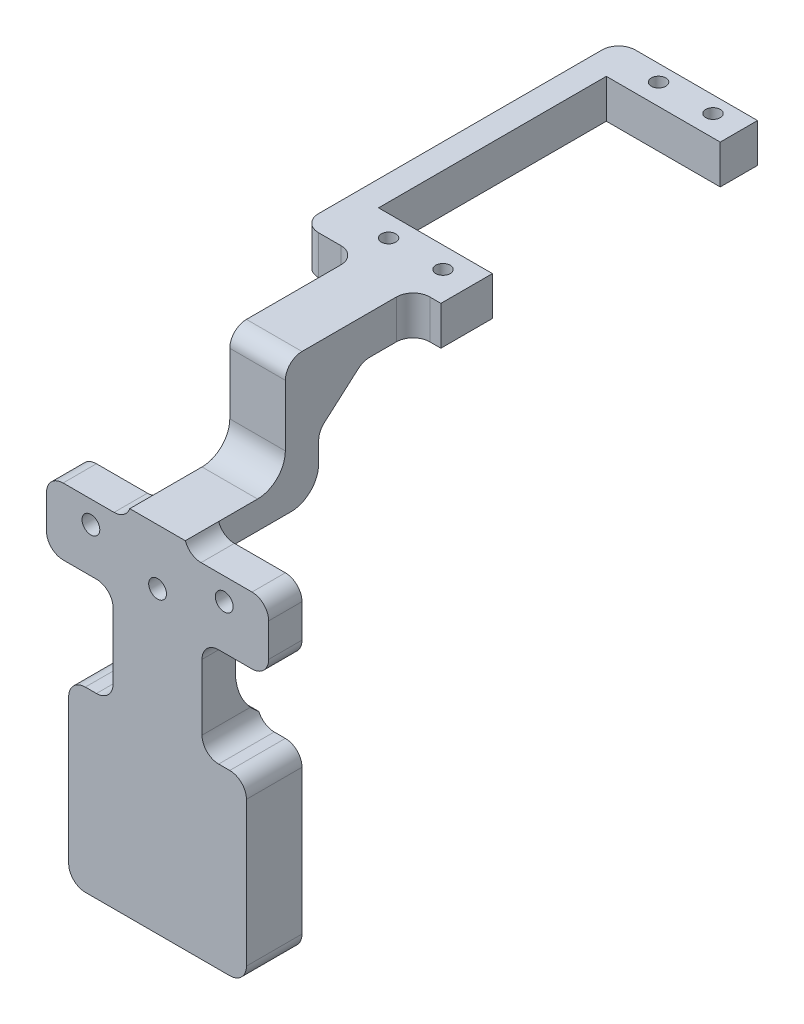
from build123d import *

# Parameters (mm, degrees)
BOSS_EXTRUDE1_DEPTH = 10
CUT_EXTRUDE1_REACH  = 126.909
FILLET1_R           = 3
SKETCH3_R           = 1.6
CUT_EXTRUDE2_DEPTH  = 6
SKETCH4_R           = 1.6
CUT_EXTRUDE3_DEPTH  = 7
BOSS_EXTRUDE2_DEPTH = 5
FILLET2_R           = 3
FILLET3_R           = 2
FILLET4_R           = 5
FILLET5_R           = 3
SKETCH7_W           = 25
SKETCH7_H           = 57
BOSS_EXTRUDE3_DEPTH = 7
SKETCH8_R           = 1.304654563
SKETCH8_W           = 21.294220064
SKETCH8_H           = 41
CUT_EXTRUDE4_DEPTH  = 7
FILLET6_R           = 3


with BuildPart() as part:
    # Sketch1 → Boss-Extrude1 (new body)
    with BuildSketch(Plane.XY):
        with BuildLine():
            Line((-13, -85.907758216), (-8, -85.907758216))
            Line((-8, -85.907758216), (-8, -68.093529717))
            Line((-8, -68.093529717), (-20, -68.093529717))
            Line((-20, -68.093529717), (-20, -56.093529717))
            Line((-20, -56.093529717), (20, -56.093529717))
            Line((20, -56.093529717), (20, -68.093529717))
            Line((20, -68.093529717), (8, -68.093529717))
            Line((8, -68.093529717), (8, -85.907758216))
            Line((8, -85.907758216), (13, -85.907758216))
            ThreePointArc((13, -85.907758216), (15.121320344, -86.786437873), (16, -88.907758216))
            Line((16, -88.907758216), (16, -114.907758216))
            ThreePointArc((16, -114.907758216), (15.121320344, -117.02907856), (13, -117.907758216))
            Line((13, -117.907758216), (-13, -117.907758216))
            ThreePointArc((-13, -117.907758216), (-15.121320344, -117.02907856), (-16, -114.907758216))
            Line((-16, -114.907758216), (-16, -88.907758216))
            ThreePointArc((-16, -88.907758216), (-15.121320344, -86.786437873), (-13, -85.907758216))
        make_face()
    extrude(amount=BOSS_EXTRUDE1_DEPTH)

    # Cut-Extrude1: up to this face of the body (flat: up to its plane)
    cut_extrude1_end = Plane(part.part.faces().sort_by_distance((-20, -62.093529717, 5))[0])
    # Sketch2 → Cut-Extrude1 (cut, up to the picked face)
    with BuildSketch(Plane(origin=(20, 0, 0), x_dir=(0, 0, -1), z_dir=(1, 0, 0)), mode=Mode.PRIVATE) as cut_extrude1_sk1:
        with BuildLine():
            Line((-4, -56.093529717), (-4, -75.944087362))
            ThreePointArc((-4, -75.944087362), (-2.946090025, -80.483178975), (0, -84.093529717))
            Line((0, -84.093529717), (0, -56.093529717))
            Line((0, -56.093529717), (-4, -56.093529717))
        make_face()
    cut_extrude1_tool1 = split(extrude(cut_extrude1_sk1.sketch, amount=-CUT_EXTRUDE1_REACH, mode=Mode.PRIVATE), bisect_by=cut_extrude1_end, keep=Keep.BOTH, mode=Mode.PRIVATE)
    add(cut_extrude1_tool1.solids().sort_by(Axis((20, -68.93128, 1.917617), (-1, 0, 0)))[0], mode=Mode.SUBTRACT)

    # Fillet1
    # the kernel refuses this fillet: 3 mm, written as the material it adds along each edge
    with BuildSketch(Plane(origin=(-8, -68.093529717, 4), x_dir=(0, -1, 0), z_dir=(0, 0, 1))) as fillet1_piece_1:
        with BuildLine():
            CenterArc((FILLET1_R, -FILLET1_R), FILLET1_R, 90, 90)
            Line((0, -FILLET1_R), (0, 0))
            Line((0, 0), (FILLET1_R, 0))
        make_face()
    extrude(amount=6)
    with BuildSketch(Plane(origin=(8, -68.093529717, 4), x_dir=(0, -1, 0), z_dir=(0, 0, 1))) as fillet1_piece_2:
        with BuildLine():
            CenterArc((FILLET1_R, FILLET1_R), FILLET1_R, 180, 90)
            Line((0, FILLET1_R), (0, 0))
            Line((0, 0), (FILLET1_R, 0))
        make_face()
    extrude(amount=6)
    with BuildSketch(Plane(origin=(-8, -85.907758216, 0), x_dir=(-1, 0, 0), z_dir=(0, 0, 1))) as fillet1_piece_3_section:
        with BuildLine():
            CenterArc((FILLET1_R, -FILLET1_R), FILLET1_R, 90, 90)
            Line((0, -FILLET1_R), (0, 0))
            Line((0, 0), (FILLET1_R, 0))
        make_face()
    fillet1_piece_3 = extrude(amount=10, mode=Mode.PRIVATE)
    fillet1_piece_3 = fillet1_piece_3 - Plane(origin=(-8.681614659, -75.944087362, -6.301676338), x_dir=(0, 0, 1), z_dir=(1, 0, 0)) * Cylinder(10.301676338, 32, mode=Mode.PRIVATE)
    add(fillet1_piece_3)
    with BuildSketch(Plane(origin=(8, -85.907758216, 0), x_dir=(1, 0, 0), z_dir=(0, 0, 1))) as fillet1_piece_4_section:
        with BuildLine():
            CenterArc((FILLET1_R, FILLET1_R), FILLET1_R, 180, 90)
            Line((0, FILLET1_R), (0, 0))
            Line((0, 0), (FILLET1_R, 0))
        make_face()
    fillet1_piece_4 = extrude(amount=10, mode=Mode.PRIVATE)
    fillet1_piece_4 = fillet1_piece_4 - Plane(origin=(8.68161466, -75.944087362, -6.301676338), x_dir=(0, 0, 1), z_dir=(1, 0, 0)) * Cylinder(10.301676338, 32, mode=Mode.PRIVATE)
    add(fillet1_piece_4)
    # the kernel refuses this fillet: 3 mm, written as the material it takes off along each edge
    with BuildSketch(Plane(origin=(-20, -68.093529717, -3.5), x_dir=(0, 1, 0), z_dir=(0, 0, 1)), Plane(origin=(-20, -56.093529717, -3.5), x_dir=(1, 0, 0), z_dir=(0, 0, 1)), Plane(origin=(20, -56.093529717, -3.5), x_dir=(0, -1, 0), z_dir=(0, 0, 1)), Plane(origin=(20, -68.093529717, -3.5), x_dir=(-1, 0, 0), z_dir=(0, 0, 1))) as fillet1_2_piece_1:
        with BuildLine():
            CenterArc((FILLET1_R, -FILLET1_R), FILLET1_R, 90, 90)
            Line((0, -FILLET1_R), (0, 0))
            Line((0, 0), (FILLET1_R, 0))
        make_face()
    extrude(amount=21, mode=Mode.SUBTRACT)

    # Sketch3 → Cut-Extrude2 (cut)
    with BuildSketch(Plane(origin=(0, 0, 4), x_dir=(-1, 0, 0), z_dir=(0, 0, -1))):
        with Locations(Location((-12, -60.093529717, 0), (0, 0, 90))):
            Circle(SKETCH3_R)
        with Locations(Location((0, -64.093529717, 0), (0, 0, 90))):
            Circle(SKETCH3_R)
        with Locations((12, -60.093529717)):
            Circle(SKETCH3_R)
    extrude(amount=-CUT_EXTRUDE2_DEPTH, mode=Mode.SUBTRACT)

    # Sketch4 → Cut-Extrude3 (cut)
    with BuildSketch(Plane(origin=(0, 0, 0), x_dir=(-1, 0, 0), z_dir=(0, 0, -1))):
        with Locations((11.66726189, -90.240496327)):
            Circle(SKETCH4_R)
        with Locations((-11.66726189, -90.240496327)):
            Circle(SKETCH4_R)
        with Locations((-11.66726189, -113.575020106)):
            Circle(SKETCH4_R)
        with Locations((11.66726189, -113.575020106)):
            Circle(SKETCH4_R)
    extrude(amount=-CUT_EXTRUDE3_DEPTH, mode=Mode.SUBTRACT)

    # Sketch5 → Boss-Extrude2 (add, symmetric)
    with BuildSketch(Plane(origin=(0, 0, 0), x_dir=(0, 0, -1), z_dir=(1, 0, 0))):
        Polygon((-10, -59.093529717), (-10, -54.093529717), (8, -54.093529717), (8, -35.093529717), (88, -35.093529717), (88, -42.093529717), (22, -42.093529717), (14, -49.093529717), (14, -59.093529717), align=None)
    extrude(amount=BOSS_EXTRUDE2_DEPTH, both=True)

    # Fillet2
    # the kernel refuses this fillet: 3 mm, written as the material it adds along each edge
    with BuildSketch(Plane(origin=(-5, -56.093529717, 4), x_dir=(-1, 0, 0), z_dir=(0, 0, 1))) as fillet2_piece_1:
        with BuildLine():
            CenterArc((2.828427125, -3), FILLET2_R, 90, 70.528779366)
            Line((0, -2), (-0.056568542, -1.98))
            ThreePointArc((-0.056568542, -1.98), (-0.06, -1), (-0.06, 0))
            Line((-0.06, 0), (0, 0.06))
            Line((0, 0.06), (2.828427125, 0.06))
            Line((2.828427125, 0.06), (2.828427125, 0))
        make_face()
    extrude(amount=6)
    with BuildSketch(Plane(origin=(5, -56.093529717, 4), x_dir=(1, 0, 0), z_dir=(0, 0, 1))) as fillet2_piece_2:
        with BuildLine():
            CenterArc((2.828427125, 3), FILLET2_R, 199.471220634, 70.528779366)
            Line((0, 2), (-0.056568542, 1.98))
            ThreePointArc((-0.056568542, 1.98), (-0.06, 1), (-0.06, 0))
            Line((-0.06, 0), (0, -0.06))
            Line((0, -0.06), (2.828427125, -0.06))
            Line((2.828427125, -0.06), (2.828427125, 0))
        make_face()
    extrude(amount=6)

    # Fillet3
    fillet3_edges = [part.edges().sort_by_distance(p)[0] for p in [
        (0, -59.093529717, 4),
    ]]
    fillet(fillet3_edges, radius=FILLET3_R)

    # Fillet4
    fillet4_edges = [part.edges().sort_by_distance(p)[0] for p in [
        (0, -59.093529717, -14),
        (0, -54.093529717, -8),
    ]]
    fillet(fillet4_edges, radius=FILLET4_R)

    # Fillet5
    fillet5_edges = [part.edges().sort_by_distance(p)[0] for p in [
        (0, -35.093529717, -8),
    ]]
    fillet(fillet5_edges, radius=FILLET5_R)

    # Sketch7 → Boss-Extrude3 (add)
    with BuildSketch(Plane(origin=(0, -35.093529717, 0), x_dir=(1, 0, 0), z_dir=(0, 1, 0))):
        with Locations((-2.5, 59.5)):
            Rectangle(SKETCH7_W, SKETCH7_H)
    extrude(amount=-BOSS_EXTRUDE3_DEPTH)

    # Sketch8 → Cut-Extrude4 (cut)
    with BuildSketch(Plane(origin=(0, -35.093529717, 0), x_dir=(1, 0, 0), z_dir=(0, 1, 0))):
        with Locations(Location((-4.9, 85.08, 0), (0, 0, 270))):
            Circle(SKETCH8_R)
        with Locations(Location((4.9, 85.08, 0), (0, 0, 270))):
            Circle(SKETCH8_R)
        with Locations(Location((4.9, 36.48, 0), (0, 0, 270))):
            Circle(SKETCH8_R)
        with Locations(Location((-4.9, 36.48, 0), (0, 0, 270))):
            Circle(SKETCH8_R)
        with Locations((0.147110032, 60.78)):
            Rectangle(SKETCH8_W, SKETCH8_H)
    extrude(amount=-CUT_EXTRUDE4_DEPTH, mode=Mode.SUBTRACT)

    # Fillet6
    fillet6_edges = [part.edges().sort_by_distance(p)[0] for p in [
        (0, -49.093529717, -14),
        (0, -42.093529717, -22),
        (5, -38.593529717, -31),
        (-5, -38.593529717, -31),
        (-15, -38.593529717, -31),
        (-15, -38.593529717, -88),
    ]]
    fillet(fillet6_edges, radius=FILLET6_R)


solid = part.part
